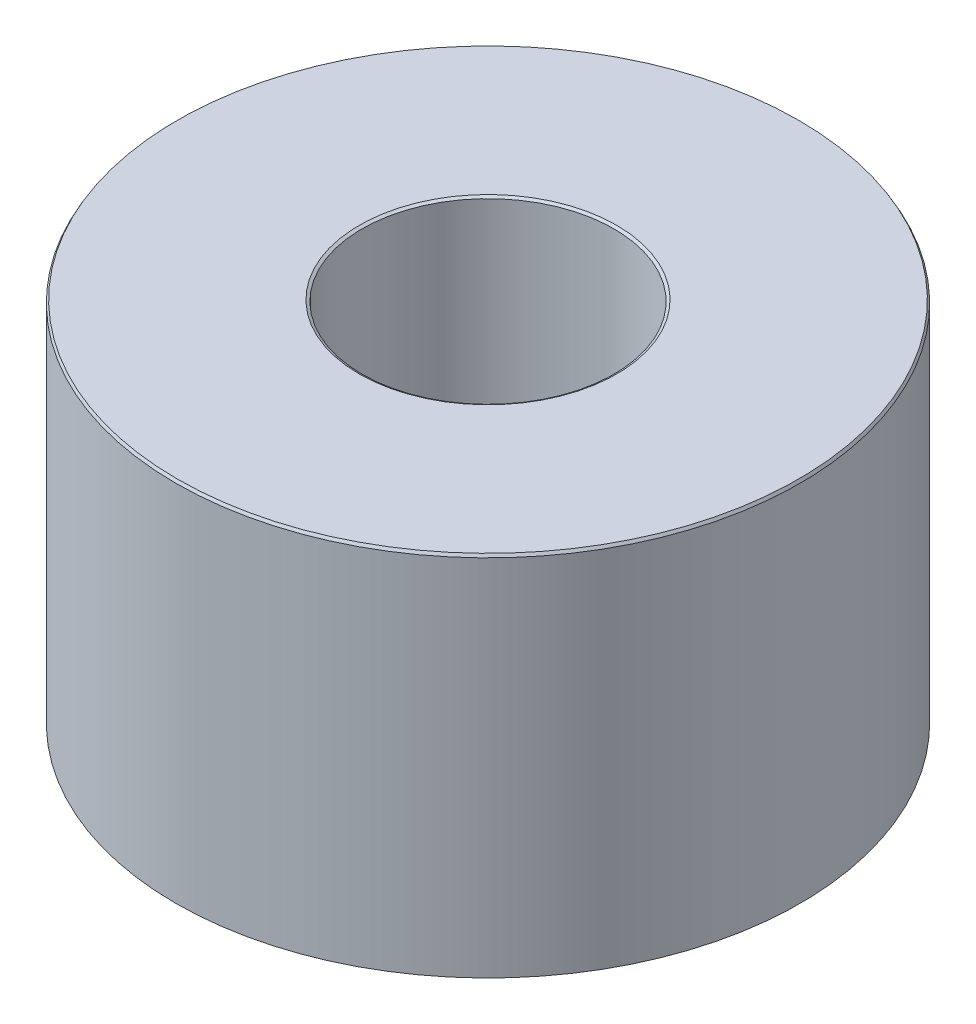
from build123d import *
from OCP.BRepFilletAPI import BRepFilletAPI_MakeChamfer

# Parameters (mm, degrees)
SKETCH1_R           = 22.5
BOSS_EXTRUDE1_DEPTH = 26.532283161
SKETCH2_R           = 9.075775762
CUT_EXTRUDE1_DEPTH  = 42.430206972
CHAMFER1_SIZE       = 0.201028805
CHAMFER1_SIZE2      = 0.116064035


with BuildPart() as part:
    # Sketch1 → Boss-Extrude1 (new body)
    with BuildSketch(Plane(origin=(0, 0, 0), x_dir=(1, 0, 0), z_dir=(0, 1, 0))):
        Circle(SKETCH1_R)
    extrude(amount=BOSS_EXTRUDE1_DEPTH)

    # Sketch2 → Cut-Extrude1 (cut, through all)
    with BuildSketch(Plane(origin=(0, 0, 0), x_dir=(1, 0, 0), z_dir=(0, 1, 0))):
        Circle(SKETCH2_R)
    extrude(amount=CUT_EXTRUDE1_DEPTH, mode=Mode.SUBTRACT)

    # Chamfer1: one chamfer whose edges measure the first distance from different faces: ONE call of the kernel's chamfer builder (chamfer() names one face for all edges)
    chamfer1_edges_1 = [part.edges().sort_by_distance(p)[0] for p in [
        (-9.075775762, 26.532283161, 0),
    ]]
    chamfer1_side_1 = [part.faces().sort_by_distance(p)[0] for p in [
        (-21.863603897, 26.532283161, 0),
    ]]
    chamfer1_edges_2 = [part.edges().sort_by_distance(p)[0] for p in [
        (-9.075775762, 0, 0),
    ]]
    chamfer1_side_2 = [part.faces().sort_by_distance(p)[0] for p in [
        (-9.075775762, 13.26614158, 0),
    ]]
    chamfer1_edges_3 = [part.edges().sort_by_distance(p)[0] for p in [
        (-22.5, 0, 0),
    ]]
    chamfer1_side_3 = [part.faces().sort_by_distance(p)[0] for p in [
        (-21.863603897, 0, 0),
    ]]
    chamfer1_edges_4 = [part.edges().sort_by_distance(p)[0] for p in [
        (-22.5, 26.532283161, 0),
    ]]
    chamfer1_side_4 = [part.faces().sort_by_distance(p)[0] for p in [
        (-22.5, 13.26614158, 0),
    ]]
    chamfer1 = BRepFilletAPI_MakeChamfer(part.part.solid().wrapped)
    for e in chamfer1_edges_1:
        chamfer1.Add(CHAMFER1_SIZE, CHAMFER1_SIZE2, e.wrapped, chamfer1_side_1[0].wrapped)  # the first distance lies on this face
    for e in chamfer1_edges_2:
        chamfer1.Add(CHAMFER1_SIZE, CHAMFER1_SIZE2, e.wrapped, chamfer1_side_2[0].wrapped)  # the first distance lies on this face
    for e in chamfer1_edges_3:
        chamfer1.Add(CHAMFER1_SIZE, CHAMFER1_SIZE2, e.wrapped, chamfer1_side_3[0].wrapped)  # the first distance lies on this face
    for e in chamfer1_edges_4:
        chamfer1.Add(CHAMFER1_SIZE, CHAMFER1_SIZE2, e.wrapped, chamfer1_side_4[0].wrapped)  # the first distance lies on this face
    add(Compound.cast(chamfer1.Shape()), mode=Mode.REPLACE)


solid = part.part
